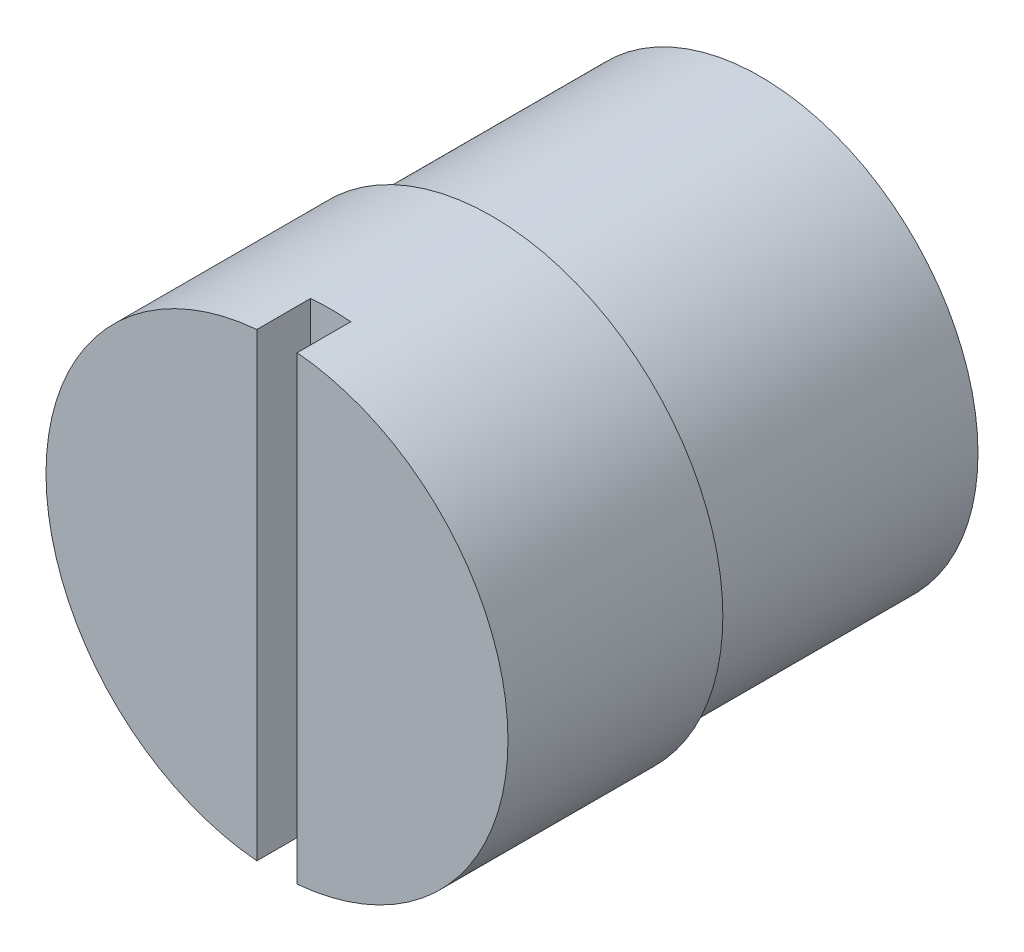
from build123d import *

# Parameters (mm, degrees)
SKETCH1_R                 = 4.05
BOSS_EXTRUDE1_DEPTH       = 5
SKETCH2_R                 = 4.3
BOSS_EXTRUDE2_DEPTH       = 4
M5X0_8_TAPPED_HOLE1_D     = 4.43
M5X0_8_TAPPED_HOLE1_DEPTH = 5
CHAMFER1_SIZE             = 0.75
THREAD1_PITCH             = 1
SKETCH3_W                 = 0.75
SKETCH3_H                 = 8.6
CUT_EXTRUDE1_DEPTH        = 1


with BuildPart() as part:
    # Sketch1 → Boss-Extrude1 (new body)
    with BuildSketch(Plane.XY):
        Circle(SKETCH1_R)
    extrude(amount=-BOSS_EXTRUDE1_DEPTH)

    # Sketch2 → Boss-Extrude2 (add)
    with BuildSketch(Plane.XY):
        Circle(SKETCH2_R)
    extrude(amount=BOSS_EXTRUDE2_DEPTH)

    # M5x0.8 Tapped Hole1
    with Locations(Plane(origin=(0, 0, -5), x_dir=(-1, 0, 0), z_dir=(0, 0, -1))):
        with Locations((0, 0)):
            Hole(M5X0_8_TAPPED_HOLE1_D / 2, depth=M5X0_8_TAPPED_HOLE1_DEPTH)

    # Chamfer1
    chamfer1_edges = [part.edges().sort_by_distance(p)[0] for p in [
        (-2.215, 0, -5),
    ]]
    chamfer(chamfer1_edges, length=CHAMFER1_SIZE)

    # Thread1: the profile of Thread Profile1 profile screwed along a right-hand helix of 5.5 turns, 8 arcs to a turn; built about Z, then put on its axis
    thread1_z = Axis((0, 0, 0), (0, 0, 1))
    thread1_corners = [(2.2147, 0, -0.000173205), (2.756265875, 0, 0.312499999), (2.756265875, 0, 0.437499999), (2.2147, 0, 0.750173202)]
    with BuildLine(mode=Mode.PRIVATE) as thread1_profile:
        Line(thread1_corners[0], thread1_corners[1])
        Line(thread1_corners[1], thread1_corners[2])
        Line(thread1_corners[2], thread1_corners[3])
        Line(thread1_corners[3], thread1_corners[0])
    thread1_cap = Face(thread1_profile.wire())
    thread1_turn_angles = [0, 22.5, 45, 67.5, 90, 112.5, 135, 157.5, 180, 202.5, 225, 247.5, 270, 292.5, 315, 337.5, 360]
    thread1_turn_weights = [1, 0.9238795325112867, 1, 0.9238795325112867, 1, 0.9238795325112867, 1, 0.9238795325112867, 1, 0.9238795325112867, 1, 0.9238795325112867, 1, 0.9238795325112867, 1, 0.9238795325112867, 1]
    thread1_turn_rails = [Edge.make_bspline([Vector(p[0], p[1], 0).rotate(thread1_z, thread1_turn_angles[k]) / thread1_turn_weights[k] + Vector(0, 0, p[2] + THREAD1_PITCH * thread1_turn_angles[k] / 360) for k in range(17)], [0, 0, 0, 1, 1, 2, 2, 3, 3, 4, 4, 5, 5, 6, 6, 7, 7, 8, 8, 8], 2, thread1_turn_weights) for p in thread1_corners]
    thread1_turn_sides = [Face.make_surface_from_curves(thread1_turn_rails[p[0]], thread1_turn_rails[p[1]]) for p in [(0, 1), (1, 2), (2, 3), (3, 0)]]
    thread1_last_angles = [1800, 1822.5, 1845, 1867.5, 1890, 1912.5, 1935, 1957.5, 1980]
    thread1_last_weights = [1, 0.9238795325112867, 1, 0.9238795325112867, 1, 0.9238795325112867, 1, 0.9238795325112867, 1]
    thread1_last_rails = [Edge.make_bspline([Vector(p[0], p[1], 0).rotate(thread1_z, thread1_last_angles[k]) / thread1_last_weights[k] + Vector(0, 0, p[2] + THREAD1_PITCH * thread1_last_angles[k] / 360) for k in range(9)], [0, 0, 0, 1, 1, 2, 2, 3, 3, 4, 4, 4], 2, thread1_last_weights) for p in thread1_corners]
    thread1_last_sides = [Face.make_surface_from_curves(thread1_last_rails[p[0]], thread1_last_rails[p[1]]) for p in [(0, 1), (1, 2), (2, 3), (3, 0)]]
    thread1 = Plane(origin=(0, 0, -6), x_dir=(1, 0, 0), z_dir=(0, 0, 1)) * Solid(Shell([*[p.moved(Location((0, 0, THREAD1_PITCH * i))) for i in range(5) for p in thread1_turn_sides], *thread1_last_sides, thread1_cap, thread1_cap.rotate(thread1_z, 1980).moved(Location((0, 0, THREAD1_PITCH * 1980 / 360)))]))
    add(thread1, mode=Mode.SUBTRACT)

    # Sketch3 → Cut-Extrude1 (cut)
    with BuildSketch(Plane.XY.offset(4)):
        Rectangle(SKETCH3_W, SKETCH3_H)
    extrude(amount=-CUT_EXTRUDE1_DEPTH, mode=Mode.SUBTRACT)


solid = part.part
